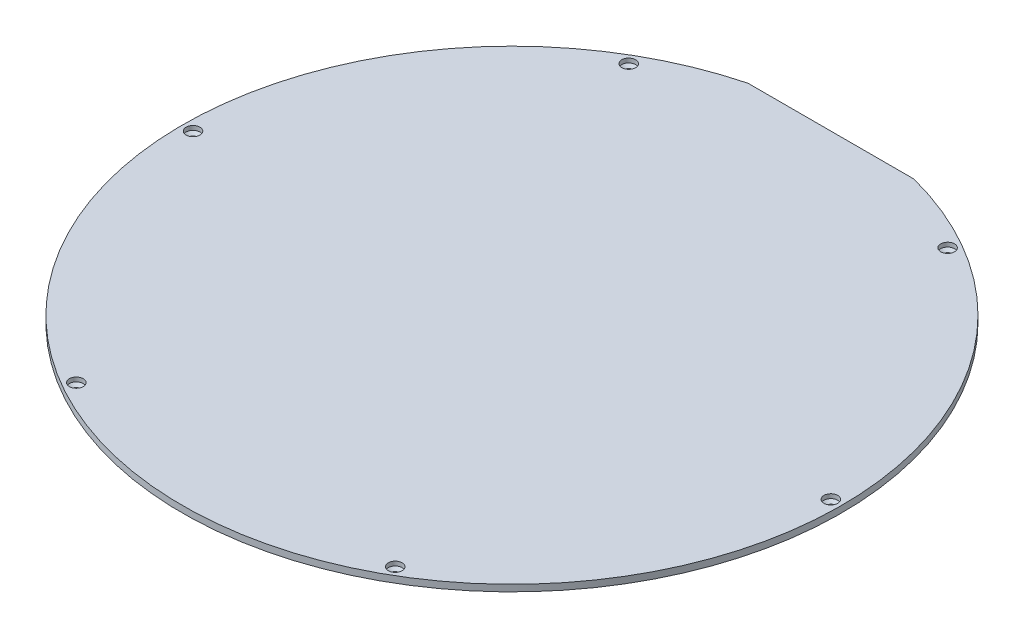
from build123d import *
from OCP.BRepFilletAPI import BRepFilletAPI_MakeChamfer

# Parameters (mm, degrees)
SKETCH1_R                      = 155
BOSS_EXTRUDE1_DEPTH            = 3.1
SKETCH2_R                      = 1.65
CUT_EXTRUDE1_DEPTH             = 220.225021382
SKETCH3_R                      = 3.25
CUT_EXTRUDE2_DEPTH             = 2
CHAMFER1_SIZE2                 = 1.6
CHAMFER1_SIZE                  = 1.1
CIRPATTERN1_COUNT              = 6
CHAMFER1_OF_CIRPATTERN1_SIZE   = 1.1
CHAMFER1_OF_CIRPATTERN1_SIZE_2 = 1.6
CUT_EXTRUDE3_DEPTH             = 220.225021382


with BuildPart() as part:
    # Sketch1 → Boss-Extrude1 (new body)
    with BuildSketch(Plane(origin=(0, 0, 0), x_dir=(1, 0, 0), z_dir=(0, 1, 0))):
        with Locations(Location((0, 0, 0), (0, 0, 90))):
            Circle(SKETCH1_R)
    extrude(amount=BOSS_EXTRUDE1_DEPTH)

    # Sketch2 → Cut-Extrude1 (cut, through all)
    with BuildSketch(Plane(origin=(0, 3.1, 0), x_dir=(1, 0, 0), z_dir=(0, 1, 0))):
        with Locations(Location((150, 0, 0), (0, 0, 270))):
            Circle(SKETCH2_R)
    cut_extrude1 = extrude(amount=-CUT_EXTRUDE1_DEPTH, mode=Mode.SUBTRACT)

    # Sketch3 → Cut-Extrude2 (cut)
    with BuildSketch(Plane(origin=(0, 3.1, 0), x_dir=(1, 0, 0), z_dir=(0, 1, 0))):
        with Locations(Location((150, 0, 0), (0, 0, 270))):
            Circle(SKETCH3_R)
    cut_extrude2 = extrude(amount=-CUT_EXTRUDE2_DEPTH, mode=Mode.SUBTRACT)

    # Chamfer1
    chamfer1_edges = [part.edges().sort_by_distance(p)[0] for p in [
        (150, 1.1, -1.65),
    ]]
    chamfer1_side = [part.faces().sort_by_distance(p)[0] for p in [
        (150, 1.078, -1.65),
    ]]
    chamfer(chamfer1_edges, length=CHAMFER1_SIZE - 0.0001, length2=CHAMFER1_SIZE2 - 0.0001, reference=chamfer1_side[0])  # a hair under: the kernel refuses the full size

    # CirPattern1: Cut-Extrude1, Cut-Extrude2 ×6 about axis
    cirpattern1_axis = Axis((0, 0, 0), (0, 1, 0))
    add([cut_extrude1.rotate(cirpattern1_axis, i * 360 / CIRPATTERN1_COUNT) for i in range(1, CIRPATTERN1_COUNT)], mode=Mode.SUBTRACT)
    add([cut_extrude2.rotate(cirpattern1_axis, i * 360 / CIRPATTERN1_COUNT) for i in range(1, CIRPATTERN1_COUNT)], mode=Mode.SUBTRACT)

    # Chamfer1 of CirPattern1
    chamfer1_of_cirpattern1_edges_1 = [part.edges().sort_by_distance(p)[0] for p in [
        (73.571058084, 1.1, -130.728810568),
    ]]
    chamfer1_of_cirpattern1_side_1 = [part.faces().sort_by_distance(p)[0] for p in [
        (73.571058084, 1.078, -130.728810568),
    ]]
    chamfer1_of_cirpattern1_edges_2 = [part.edges().sort_by_distance(p)[0] for p in [
        (-76.428941916, 1.1, -129.078810568),
    ]]
    chamfer1_of_cirpattern1_side_2 = [part.faces().sort_by_distance(p)[0] for p in [
        (-76.428941916, 1.078, -129.078810568),
    ]]
    chamfer1_of_cirpattern1_edges_3 = [part.edges().sort_by_distance(p)[0] for p in [
        (-150, 1.1, 1.65),
    ]]
    chamfer1_of_cirpattern1_side_3 = [part.faces().sort_by_distance(p)[0] for p in [
        (-150, 1.078, 1.65),
    ]]
    chamfer1_of_cirpattern1_edges_4 = [part.edges().sort_by_distance(p)[0] for p in [
        (-73.571058084, 1.1, 130.728810568),
    ]]
    chamfer1_of_cirpattern1_side_4 = [part.faces().sort_by_distance(p)[0] for p in [
        (-73.571058084, 1.078, 130.728810568),
    ]]
    chamfer1_of_cirpattern1_edges_5 = [part.edges().sort_by_distance(p)[0] for p in [
        (76.428941916, 1.1, 129.078810568),
    ]]
    chamfer1_of_cirpattern1_side_5 = [part.faces().sort_by_distance(p)[0] for p in [
        (76.428941916, 1.078, 129.078810568),
    ]]
    chamfer1_of_cirpattern1 = BRepFilletAPI_MakeChamfer(part.part.solid().wrapped)
    for e in chamfer1_of_cirpattern1_edges_1:
        chamfer1_of_cirpattern1.Add(CHAMFER1_OF_CIRPATTERN1_SIZE - 0.0001, CHAMFER1_OF_CIRPATTERN1_SIZE_2 - 0.0001, e.wrapped, chamfer1_of_cirpattern1_side_1[0].wrapped)
    for e in chamfer1_of_cirpattern1_edges_2:
        chamfer1_of_cirpattern1.Add(CHAMFER1_OF_CIRPATTERN1_SIZE - 0.0001, CHAMFER1_OF_CIRPATTERN1_SIZE_2 - 0.0001, e.wrapped, chamfer1_of_cirpattern1_side_2[0].wrapped)
    for e in chamfer1_of_cirpattern1_edges_3:
        chamfer1_of_cirpattern1.Add(CHAMFER1_OF_CIRPATTERN1_SIZE - 0.0001, CHAMFER1_OF_CIRPATTERN1_SIZE_2 - 0.0001, e.wrapped, chamfer1_of_cirpattern1_side_3[0].wrapped)
    for e in chamfer1_of_cirpattern1_edges_4:
        chamfer1_of_cirpattern1.Add(CHAMFER1_OF_CIRPATTERN1_SIZE - 0.0001, CHAMFER1_OF_CIRPATTERN1_SIZE_2 - 0.0001, e.wrapped, chamfer1_of_cirpattern1_side_4[0].wrapped)
    for e in chamfer1_of_cirpattern1_edges_5:
        chamfer1_of_cirpattern1.Add(CHAMFER1_OF_CIRPATTERN1_SIZE - 0.0001, CHAMFER1_OF_CIRPATTERN1_SIZE_2 - 0.0001, e.wrapped, chamfer1_of_cirpattern1_side_5[0].wrapped)
    add(Compound.cast(chamfer1_of_cirpattern1.Shape()), mode=Mode.REPLACE)  # a hair under: the kernel refuses the full size

    # Sketch4 → Cut-Extrude3 (cut, through all)
    with BuildSketch(Plane(origin=(0, 3.1, 0), x_dir=(1, 0, 0), z_dir=(0, 1, 0))):
        with BuildLine():
            Line((0, 150.013332741), (39, 150.013332741))
            ThreePointArc((39, 150.013332741), (0, 155), (-39, 150.013332741))
            Line((-39, 150.013332741), (0, 150.013332741))
        make_face()
    extrude(amount=-CUT_EXTRUDE3_DEPTH, mode=Mode.SUBTRACT)


solid = part.part
